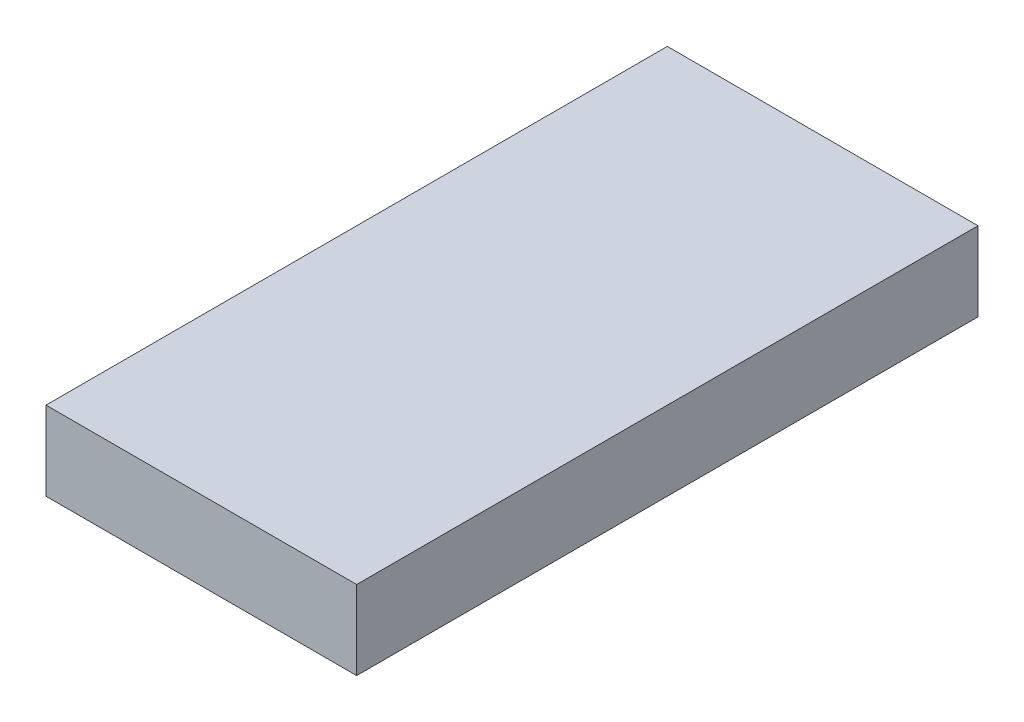
from build123d import *

# Parameters (mm, degrees)
SKETCH1_W           = 50
SKETCH1_H           = 100
BOSS_EXTRUDE1_DEPTH = 12.7


with BuildPart() as part:
    # Sketch1 → Boss-Extrude1 (new body)
    with BuildSketch(Plane(origin=(0, 0, 0), x_dir=(1, 0, 0), z_dir=(0, 1, 0))):
        Rectangle(SKETCH1_W, SKETCH1_H)
    extrude(amount=BOSS_EXTRUDE1_DEPTH)


solid = part.part
